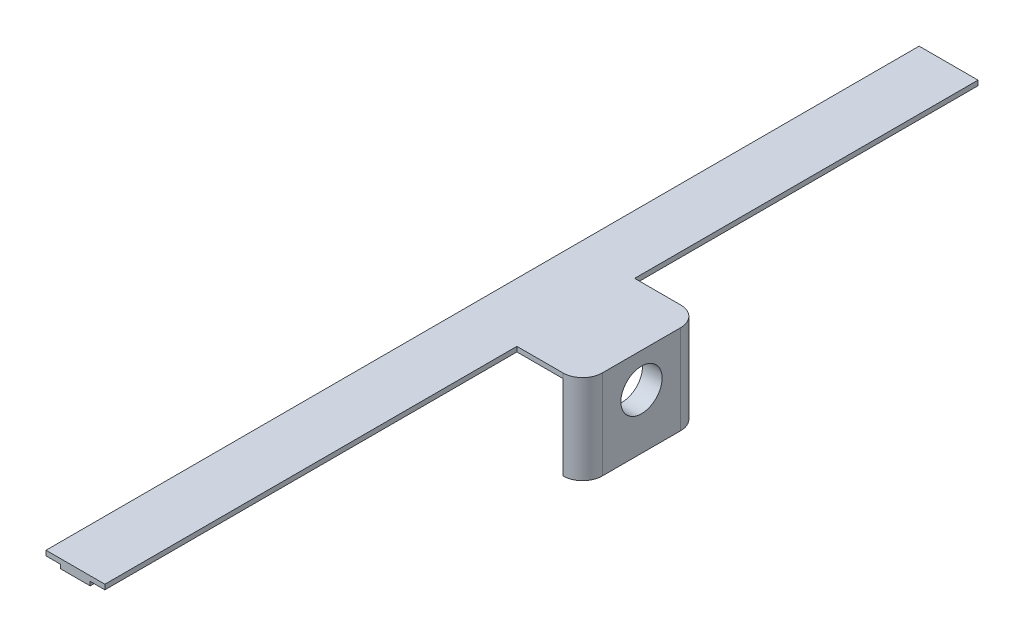
from build123d import *

# Parameters (mm, degrees)
SKETCH1_W           = 3
SKETCH1_H           = 89
BOSS_EXTRUDE1_DEPTH = 0.4
BOSS_EXTRUDE2_DEPTH = 0.5
SKETCH3_W           = 2
SKETCH3_H           = 12
BOSS_EXTRUDE3_DEPTH = 8.6
FILLET1_R           = 2
SKETCH4_R           = 2.1
CUT_EXTRUDE1_DEPTH  = 47.997659516


with BuildPart() as part:
    # Sketch1 → Boss-Extrude1 (new body)
    with BuildSketch(Plane(origin=(0, 0, 0), x_dir=(1, 0, 0), z_dir=(0, 1, 0))):
        Rectangle(SKETCH1_W, SKETCH1_H)
    extrude(amount=BOSS_EXTRUDE1_DEPTH)

    # Sketch2 → Boss-Extrude2 (add)
    with BuildSketch(Plane(origin=(0, 0.4, 0), x_dir=(1, 0, 0), z_dir=(0, 1, 0))):
        Polygon((3, 9.5), (3, 44.5), (-3, 44.5), (-3, -44.5), (3, -44.5), (3, -2.5), (9.7, -2.5), (9.7, 9.5), align=None)
    extrude(amount=BOSS_EXTRUDE2_DEPTH)

    # Sketch3 → Boss-Extrude3 (add)
    with BuildSketch(Plane.XZ.offset(-0.4)):
        with Locations((8.7, -3.5)):
            Rectangle(SKETCH3_W, SKETCH3_H)
    extrude(amount=BOSS_EXTRUDE3_DEPTH)

    # Fillet1
    fillet1_edges = [part.edges().sort_by_distance(p)[0] for p in [
        (9.7, -3.65, 2.5),
        (9.7, -3.65, -9.5),
    ]]
    fillet(fillet1_edges, radius=FILLET1_R - 0.0001)  # a hair under: the kernel refuses the full size

    # Sketch4 → Cut-Extrude1 (cut, through all)
    with BuildSketch(Plane(origin=(9.7, 0, 0), x_dir=(0, 0, -1), z_dir=(1, 0, 0))):
        with Locations((3.5, -2.6)):
            Circle(SKETCH4_R)
    extrude(amount=-CUT_EXTRUDE1_DEPTH, mode=Mode.SUBTRACT)


solid = part.part
